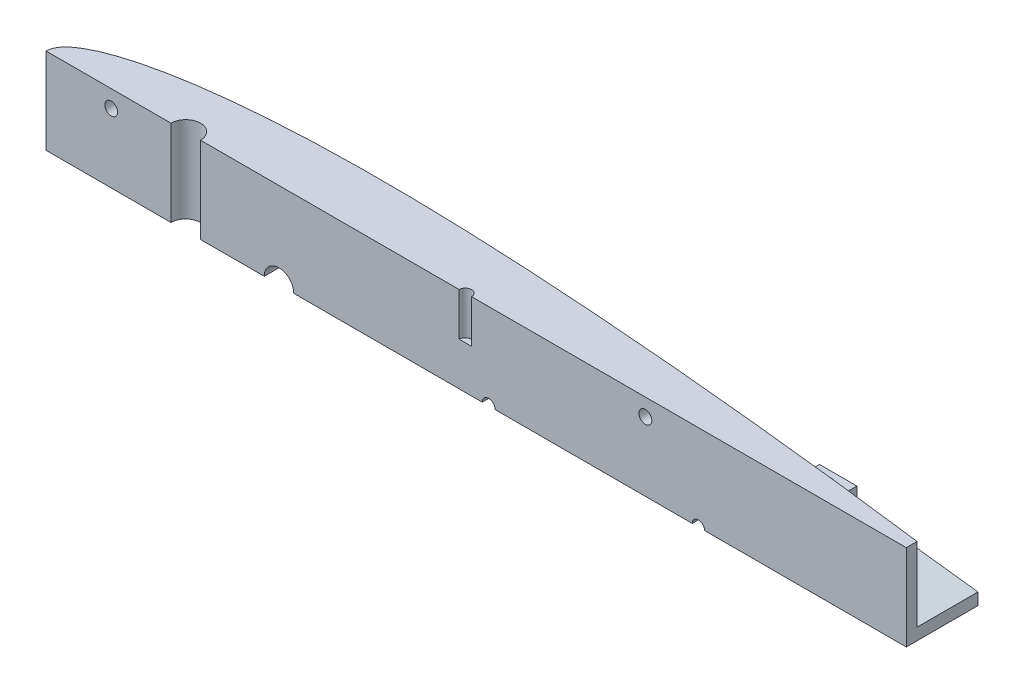
from build123d import *

# Parameters (mm, degrees)
BOSS_EXTRUDE1_DEPTH     = 25
BOSS_EXTRUDE2_DEPTH     = 30
SKETCH13_R              = 5.15
CUT_EXTRUDE8_DEPTH      = 328.337746183
SKETCH7_R               = 5.15
SKETCH7_R_2             = 2.15
SKETCH7_R_3             = 2.25
CUT_EXTRUDE7_DEPTH      = 329.252951362
CUT_EXTRUDE9_DEPTH      = 329.252951362
CUT_EXTRUDE9_DEPTH_BACK = 329.252951362
SKETCH14_W              = 25
SKETCH14_H              = 148.72296118
SKETCH13_3_R            = 2.15
CUT_EXTRUDE10_DEPTH     = 15
CUT_EXTRUDE11_DEPTH     = 4
SKETCH16_R              = 2.25
CUT_EXTRUDE12_DEPTH     = 303.530990265
SKETCH16_4_R            = 4.35
CUT_EXTRUDE14_DEPTH     = 15
SKETCH18_W              = 13.05
SKETCH18_H              = 10.44
BOSS_EXTRUDE3_DEPTH     = 20
SKETCH18_3_W            = 13.05
SKETCH18_3_H            = 8.7
BOSS_EXTRUDE4_DEPTH     = 15
SKETCH13_6_R            = 2.25
CUT_EXTRUDE18_DEPTH     = 303.530990265


with BuildPart() as part:
    # Sketch5 → Boss-Extrude1 (new body)
    with BuildSketch(Plane.XY):
        with BuildLine():
            Line((325, 0.8125), (325, 0))
            Line((325, 0), (0, 0))
            add(Edge.make_bspline(
                [(325, 0.8125), (324.209469269, 0.921419751), (322.003700809, 1.225331721), (318.130093691, 1.756964147), (313.203081724, 2.418806576), (307.751276839, 3.138180024), (301.977497958, 3.882428344), (296.033227296, 4.629952782), (290.009011969, 5.374398247), (283.950740403, 6.107941743), (277.876432063, 6.825294968), (271.790879479, 7.528200185), (265.699306561, 8.218086442), (259.607719504, 8.893526494), (253.516149602, 9.551964412), (247.420454668, 10.193582129), (241.31958931, 10.821771026), (235.21710855, 11.436453433), (229.116626208, 12.034995591), (223.019110705, 12.617530215), (216.923439137, 13.183318795), (210.82888863, 13.732306922), (204.735951015, 14.263489456), (198.645588678, 14.777223753), (192.558458018, 15.271563119), (186.475015116, 15.745953479), (180.396094786, 16.200549549), (174.322595274, 16.633294394), (168.255371118, 17.042717887), (162.194520528, 17.429048201), (156.13946647, 17.789004116), (150.090772329, 18.123377195), (144.050983869, 18.430030688), (138.023581313, 18.707272981), (132.010951859, 18.952971564), (126.012404478, 19.163679636), (120.026446486, 19.337631842), (114.052538822, 19.473028416), (108.093304522, 19.569199366), (102.15315587, 19.623040655), (96.236316011, 19.630365702), (90.346137868, 19.589596958), (84.485220536, 19.495583269), (78.65702668, 19.345218354), (72.866075349, 19.134782081), (67.118909736, 18.859098077), (61.424586593, 18.515679614), (55.796611752, 18.096952116), (50.253820272, 17.601743851), (44.82265843, 17.022444546), (39.538418263, 16.357542495), (34.451283711, 15.605530128), (29.6283839, 14.773886758), (25.154286176, 13.87903601), (21.111813877, 12.939826503), (17.554915157, 11.986788773), (14.491235236, 11.04100502), (11.887749687, 10.126064674), (9.696853949, 9.244289561), (7.862433319, 8.40233464), (6.323743507, 7.602711106), (5.026491776, 6.831942406), (3.92299008, 6.078607838), (2.974548458, 5.340894373), (2.167666579, 4.606780245), (1.501601232, 3.869655963), (0.972128321, 3.133069961), (0.570326629, 2.405952751), (0.28000866, 1.697350036), (0.091531115, 1.008739109), (0.011217022, 0.44380584), (-0.000136334, 0.109947491), (0, 0)],
                knots=[0, 0, 0, 0, 0.003612221, 0.010078953, 0.017698618, 0.026115111, 0.034970966, 0.04405038, 0.05323433, 0.06244757, 0.071673993, 0.080921319, 0.090177538, 0.099424342, 0.108664441, 0.117912199, 0.127169502, 0.136426595, 0.145675426, 0.154916495, 0.164153237, 0.173386649, 0.182615736, 0.191838089, 0.201053134, 0.210260393, 0.219458942, 0.228646747, 0.237822316, 0.246985224, 0.256137384, 0.265279416, 0.27440695, 0.283512193, 0.292591781, 0.301646285, 0.310681793, 0.319699068, 0.32869452, 0.33766016, 0.346588583, 0.355477412, 0.364322937, 0.373121614, 0.381867635, 0.390553005, 0.399166026, 0.407689628, 0.416098119, 0.424354887, 0.432412429, 0.440204728, 0.447630505, 0.454563638, 0.460855379, 0.466413319, 0.47122861, 0.475365774, 0.47890126, 0.481915077, 0.484498872, 0.486747127, 0.488741252, 0.490543179, 0.492182104, 0.493672831, 0.495031908, 0.49627906, 0.497424737, 0.498490166, 0.499502758, 0.500000006, 0.500000006, 0.500000006, 0.500000006], degree=3))
        make_face()
    extrude(amount=BOSS_EXTRUDE1_DEPTH)

    # Sketch10 → Boss-Extrude2 (add)
    with BuildSketch(Plane(origin=(0, 0, 0), x_dir=(1, 0, 0), z_dir=(0, 1, 0))):
        with BuildLine():
            Line((325, -24.590499899), (325, -25))
            Line((325, -25), (0, -25))
            add(Edge.make_bspline(
                [(325, -24.590499899), (324.20960678, -24.480600234), (322.004222006, -24.173954071), (318.131286116, -23.637520052), (313.205110102, -22.969570219), (307.754214134, -22.243438807), (301.981376014, -21.492033354), (296.038050703, -20.737140387), (290.014777157, -19.98522725), (283.95743396, -19.244173821), (277.884033962, -18.519290726), (271.79937184, -17.808841652), (265.70867326, -17.111404032), (259.617942627, -16.428412555), (253.527208066, -15.762423181), (247.432327629, -15.11324884), (241.332260133, -14.477496867), (235.230560492, -13.855249338), (229.130839249, -13.249144487), (223.034064986, -12.659050799), (216.939113888, -12.085705389), (210.845263014, -11.529161771), (204.75300295, -10.990425689), (198.663296519, -10.469140985), (192.576797706, -9.967255159), (186.493961903, -9.485322849), (180.415624113, -9.023190376), (174.342680028, -8.582915782), (168.275982363, -8.165970249), (162.215629607, -7.772125727), (156.161040662, -7.404662709), (150.112779892, -7.062790335), (144.073390404, -6.748648504), (138.04635031, -6.463933139), (132.03404416, -6.210779707), (126.03577665, -5.992634137), (120.050052914, -5.81125993), (114.07633166, -5.668456178), (108.117235085, -5.564896124), (102.177171609, -5.503689266), (96.260359175, -5.489027408), (90.370148739, -5.522492252), (84.509132999, -5.609238159), (78.680770759, -5.752375695), (72.889576441, -5.955630583), (67.142086799, -6.224187292), (61.447355471, -6.560543776), (55.818878859, -6.972291333), (50.275490506, -7.460625046), (44.843627174, -8.033187959), (39.558578915, -8.691535533), (34.470527645, -9.437237563), (29.646611553, -10.262897998), (25.171418091, -11.152198127), (21.127793712, -12.086392089), (17.569724258, -13.035016339), (14.504881071, -13.976998222), (11.900269074, -14.888707431), (9.708286733, -15.767763117), (7.872827773, -16.607440761), (6.333151204, -17.405153853), (5.034947748, -18.174311582), (3.930515344, -18.926275482), (2.981161903, -19.6628106), (2.17337223, -20.395921925), (1.50639492, -21.132218006), (0.976010289, -21.868145183), (0.573308223, -22.594761908), (0.282112492, -23.303002435), (0.092781659, -23.991377516), (0.011767303, -24.556209445), (0, -24.890052681), (0, -25)],
                knots=[0, 0, 0, 0, 0.003612221, 0.010078953, 0.017698618, 0.026115111, 0.034970966, 0.04405038, 0.05323433, 0.06244757, 0.071673993, 0.080921319, 0.090177538, 0.099424342, 0.108664441, 0.117912199, 0.127169502, 0.136426595, 0.145675426, 0.154916495, 0.164153237, 0.173386649, 0.182615736, 0.191838089, 0.201053134, 0.210260393, 0.219458942, 0.228646747, 0.237822316, 0.246985224, 0.256137384, 0.265279416, 0.27440695, 0.283512193, 0.292591781, 0.301646285, 0.310681793, 0.319699068, 0.32869452, 0.33766016, 0.346588583, 0.355477412, 0.364322937, 0.373121614, 0.381867635, 0.390553005, 0.399166026, 0.407689628, 0.416098119, 0.424354887, 0.432412429, 0.440204728, 0.447630505, 0.454563638, 0.460855379, 0.466413319, 0.47122861, 0.475365774, 0.47890126, 0.481915077, 0.484498872, 0.486747127, 0.488741252, 0.490543179, 0.492182104, 0.493672831, 0.495031908, 0.49627906, 0.497424737, 0.498490166, 0.499502758, 0.500000006, 0.500000006, 0.500000006, 0.500000006], degree=3))
        make_face()
    extrude(amount=BOSS_EXTRUDE2_DEPTH)

    # Sketch13 → Cut-Extrude8 (cut, through all)
    with BuildSketch(Plane(origin=(0, 30, 0), x_dir=(1, 0, 0), z_dir=(0, 1, 0))):
        with Locations((48.75, -25)):
            Circle(SKETCH13_R)
    extrude(amount=-CUT_EXTRUDE8_DEPTH, mode=Mode.SUBTRACT)

    # Sketch7 → Cut-Extrude7 (cut, through all)
    with BuildSketch(Plane.XY.offset(35)):
        with Locations((81.25, 0)):
            Circle(SKETCH7_R)
        with Locations((227.499996329, 0)):
            Circle(SKETCH7_R_2)
        with Locations((154.375, 0)):
            Circle(SKETCH7_R_3)
    extrude(amount=-CUT_EXTRUDE7_DEPTH, mode=Mode.SUBTRACT)

    # Sketch14 → Cut-Extrude9 (cut, two sides: drawn at the far end of the back side and taken through both)
    with BuildSketch(Plane.XY.offset(35).offset(-CUT_EXTRUDE9_DEPTH_BACK)):
        with Locations((312.5, -4.34664034)):
            Rectangle(SKETCH14_W, SKETCH14_H)
    extrude(amount=CUT_EXTRUDE9_DEPTH + CUT_EXTRUDE9_DEPTH_BACK, mode=Mode.SUBTRACT)

    # Sketch13<3> → Cut-Extrude10 (cut)
    with BuildSketch(Plane(origin=(0, 30, 0), x_dir=(1, 0, 0), z_dir=(0, 1, 0))):
        with Locations((146.25, -25)):
            Circle(SKETCH13_3_R)
    extrude(amount=-CUT_EXTRUDE10_DEPTH, mode=Mode.SUBTRACT)

    # Sketch15 → Cut-Extrude11 (cut)
    with BuildSketch(Plane(origin=(0, 0, 0), x_dir=(-1, 0, 0), z_dir=(0, 0, -1))):
        Polygon((-151.863526329, 4.35), (-156.886473671, 4.35), (-159.397947342, 0), (-156.886473671, -4.35), (-151.863526329, -4.35), (-149.352052658, 0), align=None)
    extrude(amount=-CUT_EXTRUDE11_DEPTH, mode=Mode.SUBTRACT)

    # Sketch16 → Cut-Extrude12 (cut, through all)
    with BuildSketch(Plane.XY):
        with Locations((22.74999928, 24)):
            Circle(SKETCH16_R)
        with Locations((208.99999928, 24)):
            Circle(SKETCH16_R)
    extrude(amount=CUT_EXTRUDE12_DEPTH, mode=Mode.SUBTRACT)

    # Sketch16<4> → Cut-Extrude14 (cut)
    with BuildSketch(Plane.XY):
        with Locations((208.99999928, 24)):
            Circle(SKETCH16_4_R)
        with Locations((22.74999928, 24)):
            Circle(SKETCH16_4_R)
    extrude(amount=CUT_EXTRUDE14_DEPTH, mode=Mode.SUBTRACT)

    # Sketch18 → Boss-Extrude3 (add)
    with BuildSketch(Plane(origin=(0, 0, 0), x_dir=(-1, 0, 0), z_dir=(0, -1, 0))):
        with Locations((-36.5625, -5.22)):
            Rectangle(SKETCH18_W, SKETCH18_H)
    extrude(amount=-BOSS_EXTRUDE3_DEPTH)

    # Sketch18<3> → Boss-Extrude4 (add)
    with BuildSketch(Plane(origin=(0, 0, 0), x_dir=(-1, 0, 0), z_dir=(0, -1, 0))):
        with Locations((-251.25, -4.35)):
            Rectangle(SKETCH18_3_W, SKETCH18_3_H)
    extrude(amount=-BOSS_EXTRUDE4_DEPTH)

    # Sketch13<6> → Cut-Extrude18 (cut, through all)
    with BuildSketch(Plane(origin=(0, 30, 0), x_dir=(1, 0, 0), z_dir=(0, 1, 0))):
        with Locations((36.5625, -4.35)):
            Circle(SKETCH13_6_R)
        with Locations((251.25, -4.35)):
            Circle(SKETCH13_6_R)
    extrude(amount=-CUT_EXTRUDE18_DEPTH, mode=Mode.SUBTRACT)


solid = part.part
